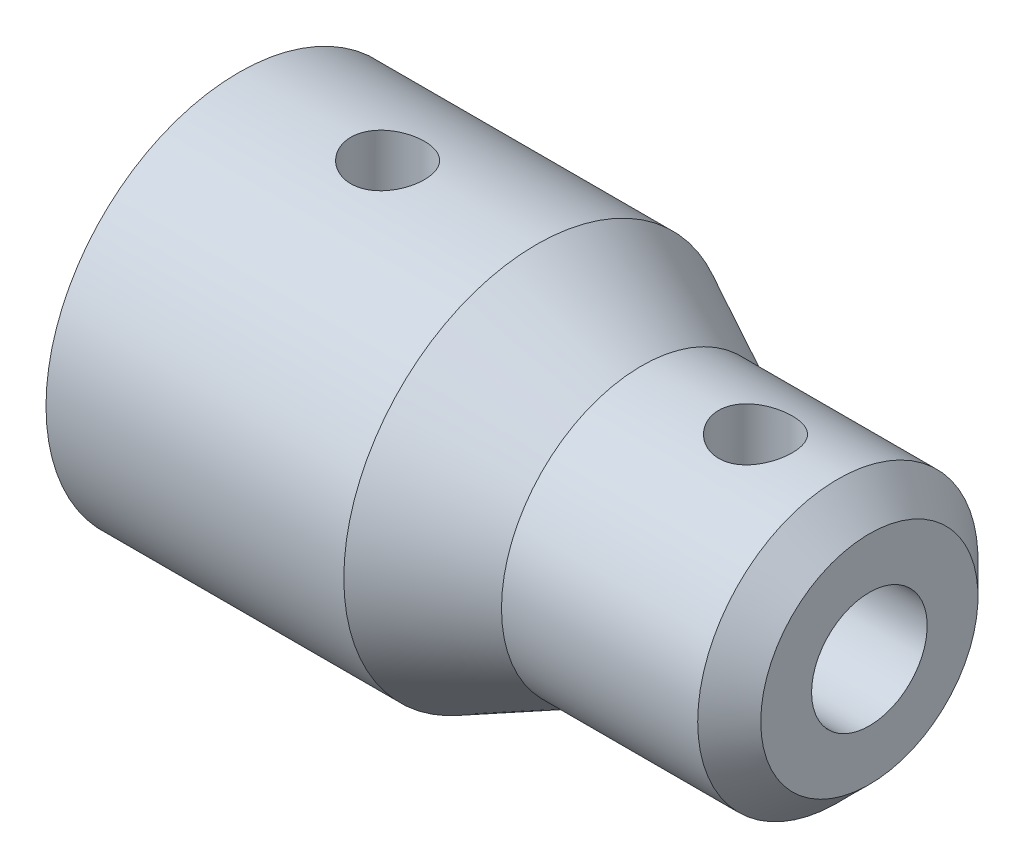
from build123d import *

# Parameters (mm, degrees)
SKETCH2_R          = 1.3335
CUT_EXTRUDE1_DEPTH = 16.59309703
CIRPATTERN1_COUNT  = 2
CIRPATTERN1_ANGLE  = 90
CHAMFER1_SIZE      = 1.143


with BuildPart() as part:
    # Sketch1 → Revolve1 (revolve)
    with BuildSketch(Plane(origin=(0, 0, 0), x_dir=(1, 0, 0), z_dir=(0, 1, 0))):
        Polygon((-10.795, 3.4036), (0, 3.4036), (1.905, 2.0955), (12.065, 2.0955), (12.065, 5.08), (3.81, 5.08), (0, 6.985), (-10.795, 6.985), align=None)
    revolve(axis=Axis((0, 0, 0), (1, 0, 0)))

    # Sketch2 → Cut-Extrude1 (cut, through all)
    with BuildSketch(Plane(origin=(0, 0, 0), x_dir=(1, 0, 0), z_dir=(0, 1, 0))):
        with Locations((-5.3975, 0)):
            Circle(SKETCH2_R)
        with Locations((7.9375, 0)):
            Circle(SKETCH2_R)
    cut_extrude1 = extrude(amount=CUT_EXTRUDE1_DEPTH, mode=Mode.SUBTRACT)

    # CirPattern1: Cut-Extrude1 ×2 about axis
    cirpattern1_axis = Axis((-10.795, 0, 0), (-1, 0, 0))
    for i in range(1, CIRPATTERN1_COUNT):
        add(cut_extrude1.rotate(cirpattern1_axis, i * CIRPATTERN1_ANGLE / (CIRPATTERN1_COUNT - 1)), mode=Mode.SUBTRACT)

    # Chamfer1
    chamfer1_edges = [part.edges().sort_by_distance(p)[0] for p in [
        (12.065, 0, 5.08),
    ]]
    chamfer(chamfer1_edges, length=CHAMFER1_SIZE)


solid = part.part
